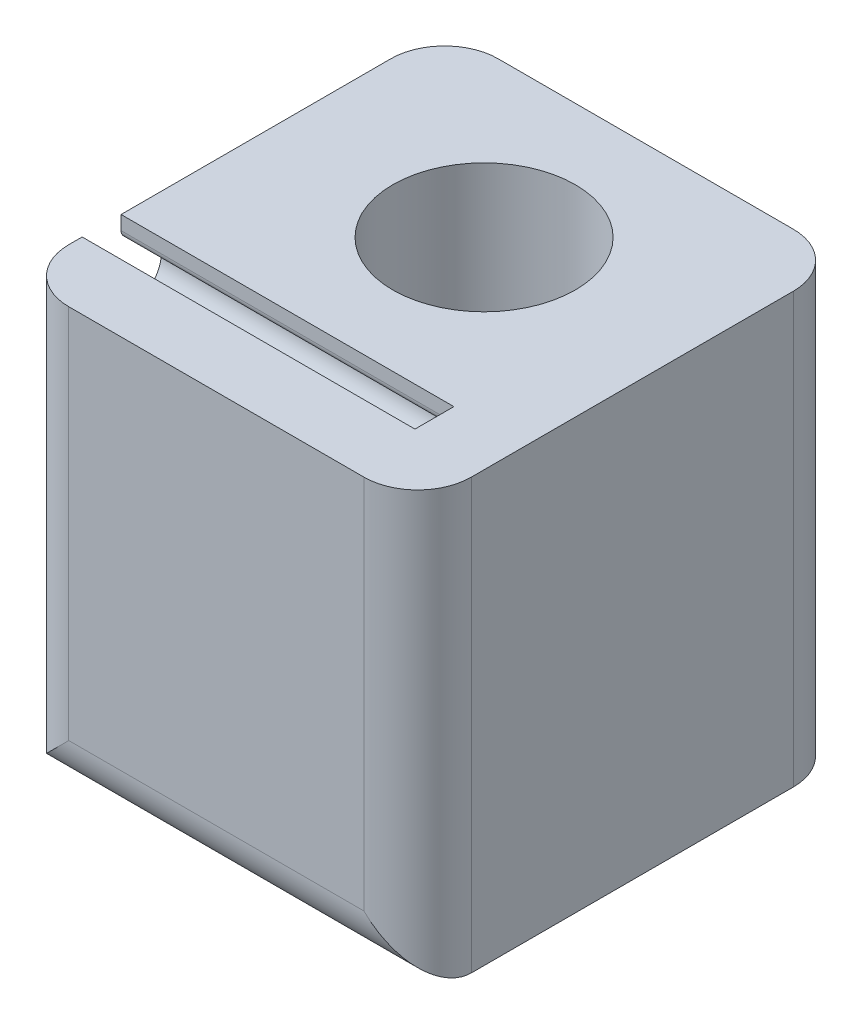
from build123d import *

# Parameters (mm, degrees)
SKETCH1_W            = 8
SKETCH1_H            = 8
BOSS_EXTRUDE1_DEPTH  = 7.5
CUT_EXTRUDE1_DEPTH   = 6.2
M3_CLEARANCE_HOLE1_D = 3.4
FILLET1_R            = 1


with BuildPart() as part:
    # Sketch1 → Boss-Extrude1 (new body)
    with BuildSketch(Plane(origin=(0, 0, 0), x_dir=(0, 0, -1), z_dir=(1, 0, 0))):
        Rectangle(SKETCH1_W, SKETCH1_H)
    extrude(amount=BOSS_EXTRUDE1_DEPTH)

    # Sketch2 → Cut-Extrude1 (cut)
    with BuildSketch(Plane(origin=(0, 0, 0), x_dir=(0, 0, -1), z_dir=(1, 0, 0))):
        with BuildLine():
            Line((-2.025, 4), (-2.025, 3.740175425))
            ThreePointArc((-2.025, 3.740175425), (-1.987771412, 3.641268354), (-1.894565217, 3.591456891))
            ThreePointArc((-1.894565217, 3.591456891), (-1.736937846, 3.557611714), (-1.586797753, 3.498876404))
            ThreePointArc((-1.586797753, 3.498876404), (-1.275, 3), (-1.586797753, 2.501123596))
            ThreePointArc((-1.586797753, 2.501123596), (-1.736937846, 2.442388286), (-1.894565217, 2.408543109))
            ThreePointArc((-1.894565217, 2.408543109), (-1.987771412, 2.358731646), (-2.025, 2.259824575))
            Line((-2.025, 2.259824575), (-2.025, 2))
            Line((-2.025, 2), (-2.025, 1.740175425))
            ThreePointArc((-2.025, 1.740175425), (-1.987771412, 1.641268354), (-1.894565217, 1.591456891))
            ThreePointArc((-1.894565217, 1.591456891), (-1.736937846, 1.557611714), (-1.586797753, 1.498876404))
            ThreePointArc((-1.586797753, 1.498876404), (-1.275, 1), (-1.586797753, 0.501123596))
            ThreePointArc((-1.586797753, 0.501123596), (-1.736937846, 0.442388286), (-1.894565217, 0.408543109))
            ThreePointArc((-1.894565217, 0.408543109), (-1.987771412, 0.358731646), (-2.025, 0.259824575))
            Line((-2.025, 0.259824575), (-2.025, 0))
            Line((-2.025, 0), (-2.025, -0.259824575))
            ThreePointArc((-2.025, -0.259824575), (-1.987771412, -0.358731646), (-1.894565217, -0.408543109))
            ThreePointArc((-1.894565217, -0.408543109), (-1.736937846, -0.442388286), (-1.586797753, -0.501123596))
            ThreePointArc((-1.586797753, -0.501123596), (-1.275, -1), (-1.586797753, -1.498876404))
            ThreePointArc((-1.586797753, -1.498876404), (-1.736937846, -1.557611714), (-1.894565217, -1.591456891))
            ThreePointArc((-1.894565217, -1.591456891), (-1.987771412, -1.641268354), (-2.025, -1.740175425))
            Line((-2.025, -1.740175425), (-2.025, -2))
            Line((-2.025, -2), (-2.025, -2.259824575))
            ThreePointArc((-2.025, -2.259824575), (-1.987771412, -2.358731646), (-1.894565217, -2.408543109))
            ThreePointArc((-1.894565217, -2.408543109), (-1.736937846, -2.442388286), (-1.586797753, -2.501123596))
            ThreePointArc((-1.586797753, -2.501123596), (-1.275, -3), (-1.586797753, -3.498876404))
            ThreePointArc((-1.586797753, -3.498876404), (-1.736937846, -3.557611714), (-1.894565217, -3.591456891))
            ThreePointArc((-1.894565217, -3.591456891), (-1.987771412, -3.641268354), (-2.025, -3.740175425))
            Line((-2.025, -3.740175425), (-2.025, -4))
            Line((-2.025, -4), (-2.75, -4))
            Line((-2.75, -4), (-2.75, 4))
            Line((-2.75, 4), (-2.025, 4))
        make_face()
    extrude(amount=CUT_EXTRUDE1_DEPTH, mode=Mode.SUBTRACT)

    # M3 Clearance Hole1 (through all)
    with Locations(Plane(origin=(0, 4, 0), x_dir=(1, 0, 0), z_dir=(0, 1, 0))):
        with Locations((3.75, 0.9875)):
            Hole(M3_CLEARANCE_HOLE1_D / 2)

    # Fillet1
    fillet1_edges = [part.edges().sort_by_distance(p)[0] for p in [
        (3.75, -4, 4),
        (7.5, 0, 4),
        (7.5, 0, -4),
        (0, 0, -4),
        (0, 0, 4),
    ]]
    fillet(fillet1_edges, radius=FILLET1_R)


solid = part.part
